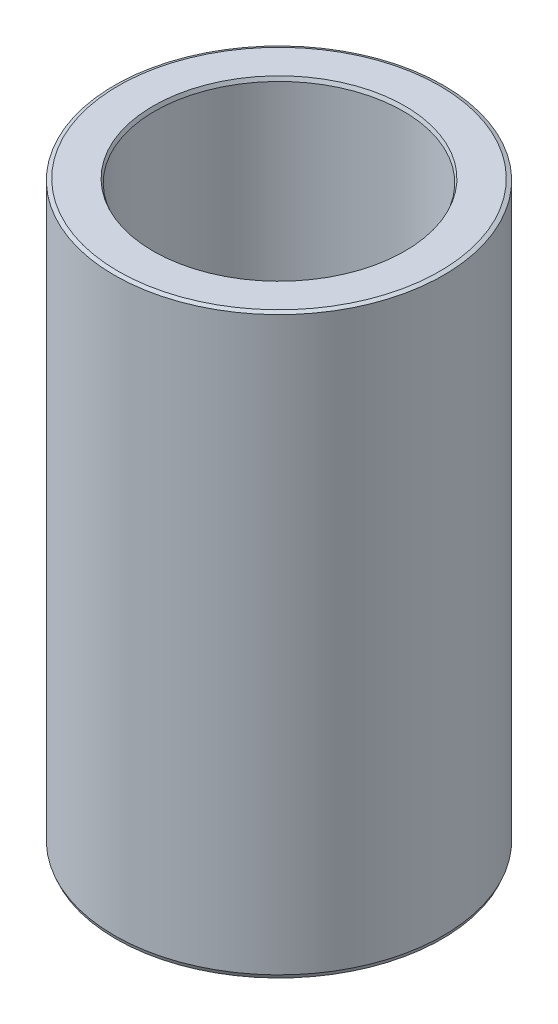
from build123d import *
from OCP.BRepFilletAPI import BRepFilletAPI_MakeChamfer

# Parameters (mm, degrees)
SKETCH1_R           = 30
BOSS_EXTRUDE1_DEPTH = 105.230688897
SKETCH2_R           = 22.665508252
CUT_EXTRUDE1_DEPTH  = 114.46143788
CHAMFER1_SIZE       = 0.278536609
CHAMFER1_SIZE2      = 0.691459795


with BuildPart() as part:
    # Sketch1 → Boss-Extrude1 (new body)
    with BuildSketch(Plane(origin=(0, 0, 0), x_dir=(1, 0, 0), z_dir=(0, 1, 0))):
        Circle(SKETCH1_R)
    extrude(amount=BOSS_EXTRUDE1_DEPTH)

    # Sketch2 → Cut-Extrude1 (cut, through all)
    with BuildSketch(Plane(origin=(0, 0, 0), x_dir=(1, 0, 0), z_dir=(0, 1, 0))):
        Circle(SKETCH2_R)
    extrude(amount=CUT_EXTRUDE1_DEPTH, mode=Mode.SUBTRACT)

    # Chamfer1: one chamfer whose edges measure the first distance from different faces: ONE call of the kernel's chamfer builder (chamfer() names one face for all edges)
    chamfer1_edges_1 = [part.edges().sort_by_distance(p)[0] for p in [
        (-22.665508252, 105.230688897, 0),
    ]]
    chamfer1_side_1 = [part.faces().sort_by_distance(p)[0] for p in [
        (-29.151471863, 105.230688897, 0),
    ]]
    chamfer1_edges_2 = [part.edges().sort_by_distance(p)[0] for p in [
        (-22.665508252, 0, 0),
    ]]
    chamfer1_side_2 = [part.faces().sort_by_distance(p)[0] for p in [
        (-22.665508252, 52.615344449, 0),
    ]]
    chamfer1_edges_3 = [part.edges().sort_by_distance(p)[0] for p in [
        (-30, 0, 0),
    ]]
    chamfer1_side_3 = [part.faces().sort_by_distance(p)[0] for p in [
        (-29.151471863, 0, 0),
    ]]
    chamfer1_edges_4 = [part.edges().sort_by_distance(p)[0] for p in [
        (-30, 105.230688897, 0),
    ]]
    chamfer1_side_4 = [part.faces().sort_by_distance(p)[0] for p in [
        (-30, 52.615344449, 0),
    ]]
    chamfer1 = BRepFilletAPI_MakeChamfer(part.part.solid().wrapped)
    for e in chamfer1_edges_1:
        chamfer1.Add(CHAMFER1_SIZE, CHAMFER1_SIZE2, e.wrapped, chamfer1_side_1[0].wrapped)  # the first distance lies on this face
    for e in chamfer1_edges_2:
        chamfer1.Add(CHAMFER1_SIZE, CHAMFER1_SIZE2, e.wrapped, chamfer1_side_2[0].wrapped)  # the first distance lies on this face
    for e in chamfer1_edges_3:
        chamfer1.Add(CHAMFER1_SIZE, CHAMFER1_SIZE2, e.wrapped, chamfer1_side_3[0].wrapped)  # the first distance lies on this face
    for e in chamfer1_edges_4:
        chamfer1.Add(CHAMFER1_SIZE, CHAMFER1_SIZE2, e.wrapped, chamfer1_side_4[0].wrapped)  # the first distance lies on this face
    add(Compound.cast(chamfer1.Shape()), mode=Mode.REPLACE)


solid = part.part
